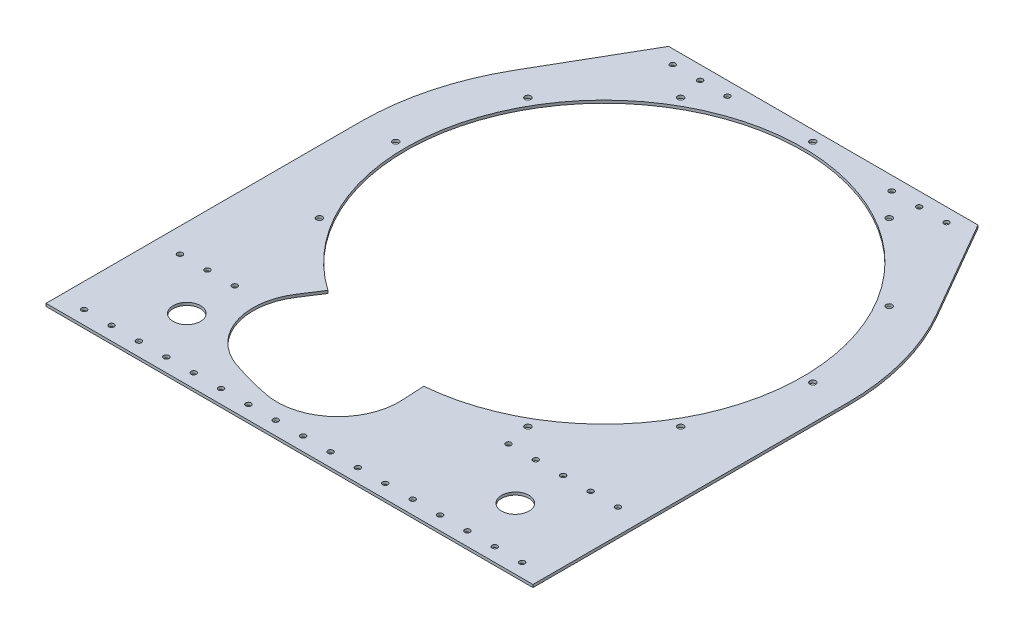
from build123d import *

# Parameters (mm, degrees)
SKETCH1_W               = 539.75
SKETCH1_H               = 495.3
BOSS_EXTRUDE1_DEPTH     = 2.54
SKETCH2_R               = 184.15
CUT_EXTRUDE1_DEPTH      = 467.904666099
CUT_EXTRUDE3_DEPTH      = 443.942729481
CUT_EXTRUDE3_DEPTH_BACK = 443.942729481
SKETCH4_OUTSIDE_W       = 587.882
SKETCH4_OUTSIDE_H       = 631.382
DELETEFACE1_DEPTH       = 2.54
F_8_CLEARANCE_HOLE1_D   = 4.9149
F_10_CLEARANCE_HOLE1_D  = 5.6134
SKETCH10_R              = 12.7
CUT_EXTRUDE4_DEPTH      = 443.942729481


# Read off the part's stored shape, not the designer's step: DeleteFace1
with BuildPart() as part:
    # Sketch1 → Boss-Extrude1 (new body)
    with BuildSketch(Plane(origin=(0, 0, 0), x_dir=(1, 0, 0), z_dir=(0, 1, 0))):
        with Locations((0, 133.35)):
            Rectangle(SKETCH1_W, SKETCH1_H)
    extrude(amount=BOSS_EXTRUDE1_DEPTH)

    # Sketch2 → Cut-Extrude1 (cut, through all)
    with BuildSketch(Plane(origin=(0, 2.54, 0), x_dir=(1, 0, 0), z_dir=(0, 1, 0))):
        with Locations(Location((0, 177.8, 0), (0, 0, 270))):
            Circle(SKETCH2_R)
        with BuildLine():
            Line((195.635138715, 290.75), (99.054025744, 458.033394716))
            Line((99.054025744, 458.033394716), (644.549965459, 478.864376008))
            Line((644.549965459, 478.864376008), (667.56593599, -123.849355899))
            Line((667.56593599, -123.849355899), (225.9, -158.139047855))
            Line((225.9, -158.139047855), (225.9, 177.8))
            ThreePointArc((225.9, 177.8), (218.202644159, 236.267222289), (195.635138715, 290.75))
        make_face()
        with BuildLine():
            Line((-99.054025744, 458.033394716), (-195.635138715, 290.75))
            ThreePointArc((-195.635138715, 290.75), (-218.202644159, 236.267222289), (-225.9, 177.8))
            Line((-225.9, 177.8), (-225.9, -158.139047855))
            Line((-225.9, -158.139047855), (-512.847328359, -198.052843622))
            Line((-512.847328359, -198.052843622), (-480.715151615, 488.522350563))
            Line((-480.715151615, 488.522350563), (-99.054025744, 458.033394716))
        make_face()
    extrude(amount=-CUT_EXTRUDE1_DEPTH, mode=Mode.SUBTRACT)

    # Sketch4 outside → Cut-Extrude3 (cut, two sides: drawn at the far end of the back side and taken through both)
    # profile 1 of 2: a face of its own
    with BuildSketch(Plane(origin=(0, 2.54, 0), x_dir=(1, 0, 0), z_dir=(0, 1, 0)).offset(-CUT_EXTRUDE3_DEPTH_BACK)):
        with Locations((0, 133.35)):
            Rectangle(SKETCH4_OUTSIDE_W, SKETCH4_OUTSIDE_H)
        with BuildLine():
            Line((195.635138715, 290.75), (143.529276921, 381))
            Line((143.529276921, 381), (-143.529276921, 381))
            Line((-143.529276921, 381), (-195.635138715, 290.75))
            ThreePointArc((-195.635138715, 290.75), (-218.202644159, 236.267222289), (-225.9, 177.8))
            Line((-225.9, 177.8), (-225.9, -114.3))
            Line((-225.9, -114.3), (225.9, -114.3))
            Line((225.9, -114.3), (225.9, 177.8))
            ThreePointArc((225.9, 177.8), (218.202644159, 236.267222289), (195.635138715, 290.75))
        make_face(mode=Mode.SUBTRACT)
    # profile 2 of 2: a face of its own
    with BuildSketch(Plane(origin=(0, 2.54, 0), x_dir=(1, 0, 0), z_dir=(0, 1, 0)).offset(-CUT_EXTRUDE3_DEPTH_BACK)):
        with BuildLine():
            Line((17.092062212, -27.00447678), (16.405511664, -13.904311929))
            ThreePointArc((16.405511664, -13.904311929), (12.375480651, -5.272574167), (3.477179505, -1.871356225))
            ThreePointArc((3.477179505, -1.871356225), (-46.5110765, 4.218299387), (-92.847003898, 23.93863093))
            ThreePointArc((-92.847003898, 23.93863093), (-102.253767711, 25.442240361), (-110.059745828, 19.981951687))
            Line((-110.059745828, 19.981951687), (-117.204398469, 8.980151406))
            ThreePointArc((-117.204398469, 8.980151406), (-123.287148558, -40.070635127), (-88.464039092, -75.146703255))
            ThreePointArc((-88.464039092, -75.146703255), (-69.355739516, -81.039143671), (-49.861246452, -85.490290368))
            ThreePointArc((-49.861246452, -85.490290368), (-2.165514952, -72.525079038), (17.092062212, -27.00447678))
        make_face()
    extrude(amount=CUT_EXTRUDE3_DEPTH + CUT_EXTRUDE3_DEPTH_BACK, mode=Mode.SUBTRACT)

    # DeleteFace1 outline → DeleteFace1 (cut)
    with BuildSketch(Plane(origin=(0, 0, 0), x_dir=(1, 0, 0), z_dir=(0, 1, 0))):
        with BuildLine():
            ThreePointArc((-103.099865089, 25.216775763), (-104.333958967, 26.057957355), (-105.561190084, 26.909120064))
            Line((-105.561190084, 26.909120064), (-110.059745828, 19.981951687))
            ThreePointArc((-110.059745828, 19.981951687), (-107.042541375, 23.214587225), (-103.099865089, 25.216775763))
        make_face()
        with BuildLine():
            Line((16.405511664, -13.904311929), (15.973232299, -5.655930266))
            ThreePointArc((15.973232299, -5.655930266), (14.484837621, -5.779443236), (12.995490176, -5.890880925))
            ThreePointArc((12.995490176, -5.890880925), (15.408853729, -9.596165205), (16.405511664, -13.904311929))
        make_face()
    extrude(amount=DELETEFACE1_DEPTH, mode=Mode.SUBTRACT)

    # #8 Clearance Hole1 (through all)
    with Locations(Plane(origin=(0, 2.54, 0), x_dir=(1, 0, 0), z_dir=(0, 1, 0))):
        with Locations((127, -101.6), (101.6, -101.6), (76.2, -101.6), (50.8, -101.6), (25.4, -101.6), (0, -101.6), (-25.4, -101.6), (-50.8, -101.6), (-76.2, -101.6), (-101.6, -101.6), (-127, -101.6), (-152.4, -101.6), (-177.8, -101.6), (-203.2, -101.6), (-152.4, -12.7), (-177.8, -12.7), (-203.2, -12.7), (101.6, -12.7), (127, -12.7), (152.4, -12.7), (152.4, -101.6), (177.8, -101.6), (203.2, -101.6), (203.2, -12.7), (177.8, -12.7), (127, 368.3), (101.6, 368.3), (76.2, 368.3), (-76.2, 368.3), (-101.6, 368.3), (-127, 368.3)):
            Hole(F_8_CLEARANCE_HOLE1_D / 2)

    # #10 Clearance Hole1 (through all)
    with Locations(Plane(origin=(0, 2.54, 0), x_dir=(1, 0, 0), z_dir=(0, 1, 0))):
        with Locations((-167.575915632, 274.55), (-96.75, 345.375915632), (0, 371.3), (96.75, 345.375915632), (167.575915632, 274.55), (193.5, 177.8), (167.575915632, 81.05), (96.75, 10.224084368), (-167.575915632, 81.05), (-193.5, 177.8)):
            Hole(F_10_CLEARANCE_HOLE1_D / 2)

    # Sketch10 → Cut-Extrude4 (cut, through all)
    with BuildSketch(Plane(origin=(0, 2.54, 0), x_dir=(1, 0, 0), z_dir=(0, 1, 0))):
        with Locations(Location((-152.4, -57.15, 0), (0, 0, 270))):
            Circle(SKETCH10_R)
        with Locations(Location((152.4, -57.15, 0), (0, 0, 270))):
            Circle(SKETCH10_R)
    extrude(amount=-CUT_EXTRUDE4_DEPTH, mode=Mode.SUBTRACT)


solid = part.part
